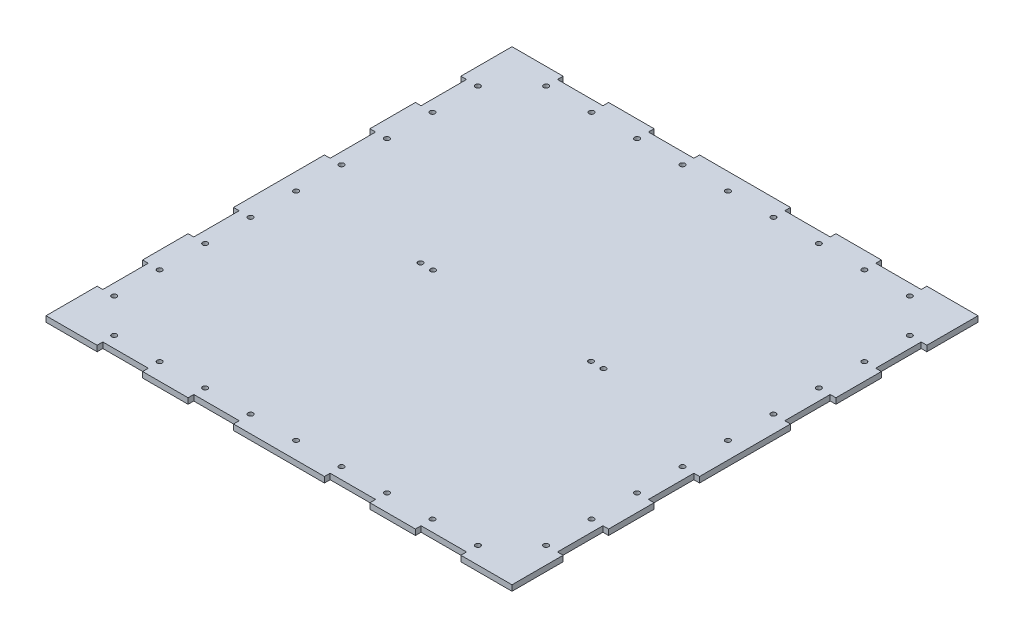
from build123d import *

# Parameters (mm, degrees)
SKETCH_1_R          = 2.2
EXTRUDE_1_DEPTH     = 5
SKETCH_2_R          = 2.2
CUT_EXTRUDE_2_DEPTH = 20


with BuildPart() as part:
    # 草图1 → 凸台-拉伸1 (new body)
    with BuildSketch(Plane(origin=(0, 0, 0), x_dir=(1, 0, 0), z_dir=(0, 1, 0))):
        Polygon((80, 200), (40, 200), (40, 205), (-40, 205), (-40, 200), (-80, 200), (-80, 205), (-120, 205), (-120, 200), (-160, 200), (-160, 205), (-200, 205), (-205, 205), (-205, 200), (-205, 160), (-200, 160), (-200, 120), (-205, 120), (-205, 80), (-200, 80), (-200, 40), (-205, 40), (-205, -40), (-200, -40), (-200, -80), (-205, -80), (-205, -120), (-200, -120), (-200, -160), (-205, -160), (-205, -200), (-205, -205), (-200, -205), (-160, -205), (-160, -200), (-120, -200), (-120, -205), (-80, -205), (-80, -200), (-40, -200), (-40, -205), (40, -205), (40, -200), (80, -200), (80, -205), (120, -205), (120, -200), (160, -200), (160, -205), (200, -205), (205, -205), (205, -200), (205, -160), (200, -160), (200, -120), (205, -120), (205, -80), (200, -80), (200, -40), (205, -40), (205, 40), (200, 40), (200, 80), (205, 80), (205, 120), (200, 120), (200, 160), (205, 160), (205, 200), (205, 205), (200, 205), (160, 205), (160, 200), (120, 200), (120, 205), (80, 205), align=None)
        with Locations((-160, -190)):
            Circle(SKETCH_1_R, mode=Mode.SUBTRACT)
        with Locations((-190, -160)):
            Circle(SKETCH_1_R, mode=Mode.SUBTRACT)
        with Locations((-120, -190)):
            Circle(SKETCH_1_R, mode=Mode.SUBTRACT)
        with Locations((-190, -120)):
            Circle(SKETCH_1_R, mode=Mode.SUBTRACT)
        with Locations((-80, -190)):
            Circle(SKETCH_1_R, mode=Mode.SUBTRACT)
        with Locations((-40, -190)):
            Circle(SKETCH_1_R, mode=Mode.SUBTRACT)
        with Locations((0, -190)):
            Circle(SKETCH_1_R, mode=Mode.SUBTRACT)
        with Locations((-190, -80)):
            Circle(SKETCH_1_R, mode=Mode.SUBTRACT)
        with Locations((-190, -40)):
            Circle(SKETCH_1_R, mode=Mode.SUBTRACT)
        with Locations((40, -190)):
            Circle(SKETCH_1_R, mode=Mode.SUBTRACT)
        with Locations((80, -190)):
            Circle(SKETCH_1_R, mode=Mode.SUBTRACT)
        with Locations((120, -190)):
            Circle(SKETCH_1_R, mode=Mode.SUBTRACT)
        with Locations((160, -190)):
            Circle(SKETCH_1_R, mode=Mode.SUBTRACT)
        with Locations((190, -160)):
            Circle(SKETCH_1_R, mode=Mode.SUBTRACT)
        with Locations((190, -120)):
            Circle(SKETCH_1_R, mode=Mode.SUBTRACT)
        with Locations((190, -80)):
            Circle(SKETCH_1_R, mode=Mode.SUBTRACT)
        with Locations((190, -40)):
            Circle(SKETCH_1_R, mode=Mode.SUBTRACT)
        with Locations((190, 0)):
            Circle(SKETCH_1_R, mode=Mode.SUBTRACT)
        with Locations((-190, 0)):
            Circle(SKETCH_1_R, mode=Mode.SUBTRACT)
        with Locations((-190, 40)):
            Circle(SKETCH_1_R, mode=Mode.SUBTRACT)
        with Locations((-190, 80)):
            Circle(SKETCH_1_R, mode=Mode.SUBTRACT)
        with Locations((-190, 120)):
            Circle(SKETCH_1_R, mode=Mode.SUBTRACT)
        with Locations((-190, 160)):
            Circle(SKETCH_1_R, mode=Mode.SUBTRACT)
        with Locations((-160, 190)):
            Circle(SKETCH_1_R, mode=Mode.SUBTRACT)
        with Locations((-120, 190)):
            Circle(SKETCH_1_R, mode=Mode.SUBTRACT)
        with Locations((-80, 190)):
            Circle(SKETCH_1_R, mode=Mode.SUBTRACT)
        with Locations((-40, 190)):
            Circle(SKETCH_1_R, mode=Mode.SUBTRACT)
        with Locations((190, 40)):
            Circle(SKETCH_1_R, mode=Mode.SUBTRACT)
        with Locations((190, 80)):
            Circle(SKETCH_1_R, mode=Mode.SUBTRACT)
        with Locations((0, 190)):
            Circle(SKETCH_1_R, mode=Mode.SUBTRACT)
        with Locations((40, 190)):
            Circle(SKETCH_1_R, mode=Mode.SUBTRACT)
        with Locations((80, 190)):
            Circle(SKETCH_1_R, mode=Mode.SUBTRACT)
        with Locations((190, 120)):
            Circle(SKETCH_1_R, mode=Mode.SUBTRACT)
        with Locations((120, 190)):
            Circle(SKETCH_1_R, mode=Mode.SUBTRACT)
        with Locations((190, 160)):
            Circle(SKETCH_1_R, mode=Mode.SUBTRACT)
        with Locations((160, 190)):
            Circle(SKETCH_1_R, mode=Mode.SUBTRACT)
    extrude(amount=EXTRUDE_1_DEPTH)

    # 草图2 → 切除-拉伸2 (cut)
    with BuildSketch(Plane(origin=(0, 5, 0), x_dir=(1, 0, 0), z_dir=(0, 1, 0))):
        with Locations((69.5, 0)):
            Circle(SKETCH_2_R)
        with Locations((-80.5, 0)):
            Circle(SKETCH_2_R)
        with Locations((80.5, 0)):
            Circle(SKETCH_2_R)
        with Locations((-69.5, 0)):
            Circle(SKETCH_2_R)
    extrude(amount=-CUT_EXTRUDE_2_DEPTH, mode=Mode.SUBTRACT)


solid = part.part
